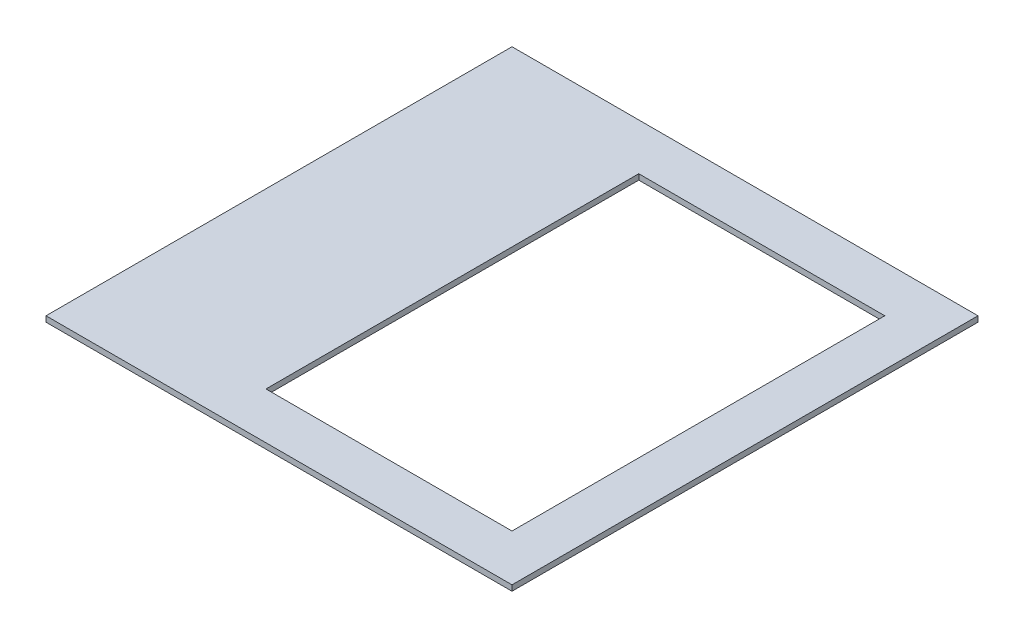
from build123d import *

# Parameters (mm, degrees)
SKETCH_1_W          = 250
SKETCH_1_H          = 250
EXTRUDE_1_DEPTH     = 3
SKETCH_3_W          = 132
SKETCH_3_H          = 200
CUT_EXTRUDE_1_DEPTH = 10


with BuildPart() as part:
    # Эскиз1 → Бобышка-Вытянуть1 (new body)
    with BuildSketch(Plane(origin=(0, 0, 0), x_dir=(1, 0, 0), z_dir=(0, 1, 0))):
        Rectangle(SKETCH_1_W, SKETCH_1_H)
    extrude(amount=EXTRUDE_1_DEPTH)

    # Эскиз3 → Вырез-Вытянуть1 (cut)
    with BuildSketch(Plane.XZ):
        with Locations((34, 0)):
            Rectangle(SKETCH_3_W, SKETCH_3_H)
    extrude(amount=-CUT_EXTRUDE_1_DEPTH, mode=Mode.SUBTRACT)


solid = part.part
